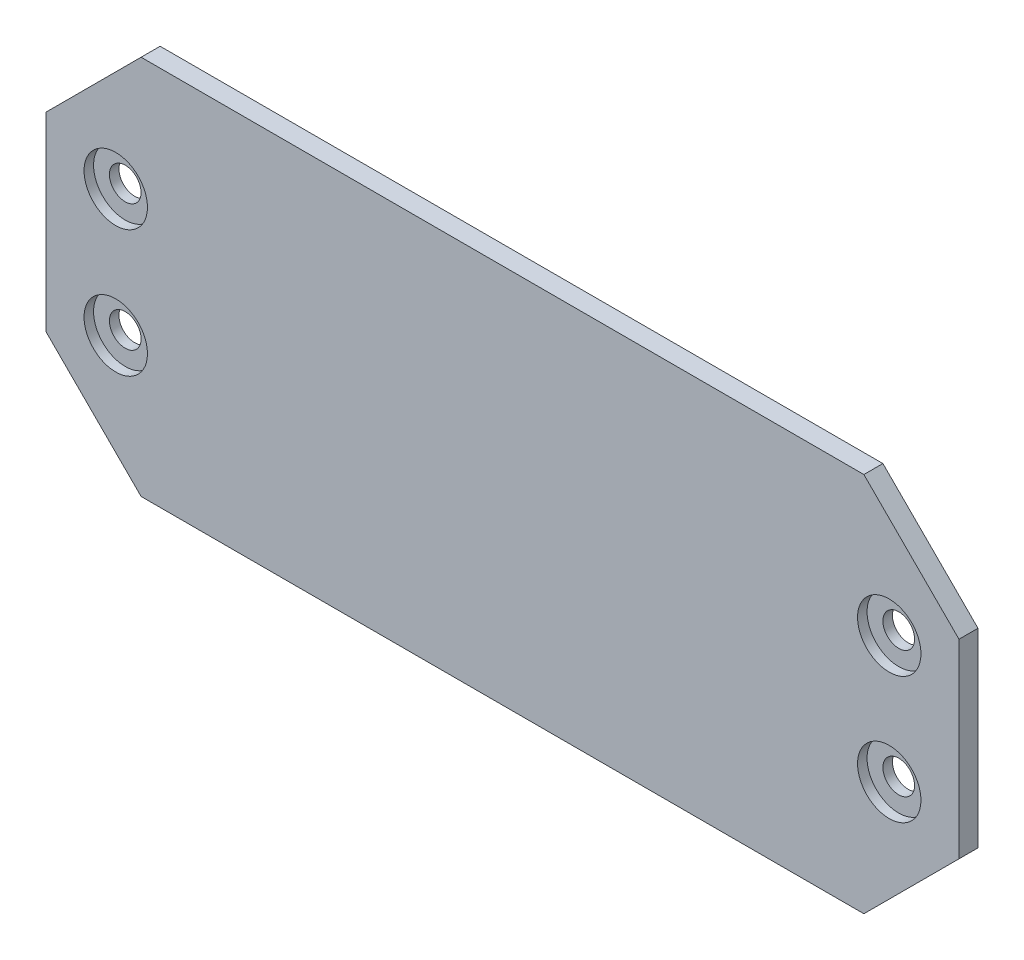
from build123d import *

# Parameters (mm, degrees)
SKETCH1_R           = 2.5
BOSS_EXTRUDE1_DEPTH = 3
SKETCH2_R           = 5
CUT_EXTRUDE1_DEPTH  = 1.5


with BuildPart() as part:
    # Sketch1 → Boss-Extrude1 (new body)
    with BuildSketch(Plane.XY):
        Polygon((-57, 30), (57, 30), (72, 15), (72, -15), (57, -30), (-57, -30), (-72, -15), (-72, 15), align=None)
        with Locations((-61, 10)):
            Circle(SKETCH1_R, mode=Mode.SUBTRACT)
        with Locations((61, 10)):
            Circle(SKETCH1_R, mode=Mode.SUBTRACT)
        with Locations((61, -10)):
            Circle(SKETCH1_R, mode=Mode.SUBTRACT)
        with Locations((-61, -10)):
            Circle(SKETCH1_R, mode=Mode.SUBTRACT)
    extrude(amount=BOSS_EXTRUDE1_DEPTH)

    # Sketch2 → Cut-Extrude1 (cut)
    with BuildSketch(Plane.XY.offset(3)):
        with Locations((-61, -10)):
            Circle(SKETCH2_R)
        with Locations((-61, 10)):
            Circle(SKETCH2_R)
        with Locations((61, 10)):
            Circle(SKETCH2_R)
        with Locations((61, -10)):
            Circle(SKETCH2_R)
    extrude(amount=-CUT_EXTRUDE1_DEPTH, mode=Mode.SUBTRACT)


solid = part.part
